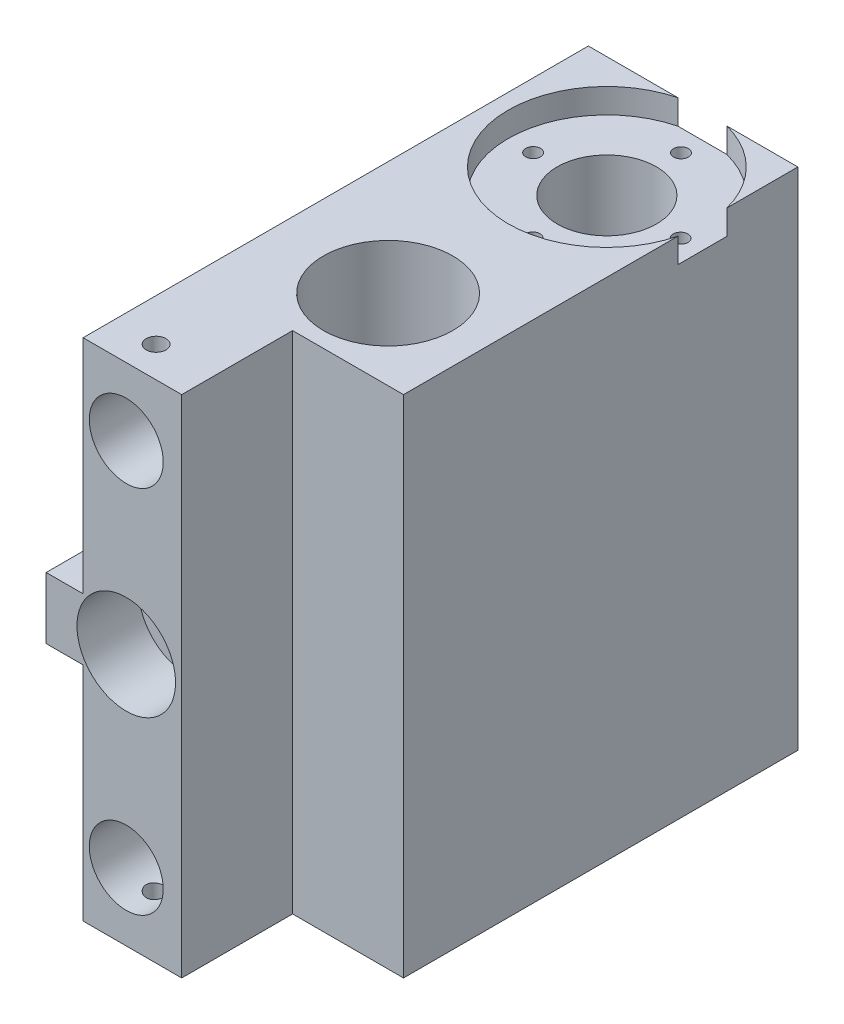
from build123d import *
from build123d.topology import SkipClean

# Parameters (mm, degrees)
SKETCH1_W           = 40
SKETCH1_H           = 82
SKETCH1_R           = 5.5
SKETCH1_R_2         = 6
BOSS_EXTRUDE1_DEPTH = 12
BOSS_EXTRUDE2_START = 70
SKETCH2_W           = 40
SKETCH2_H           = 82
SKETCH2_R           = 5.5
BOSS_EXTRUDE2_DEPTH = 70
SKETCH3_R           = 1.6
CUT_EXTRUDE1_DEPTH  = 10
CUT_EXTRUDE2_START  = -10
SKETCH4_R           = 1.6
CUT_EXTRUDE2_DEPTH  = 10
SKETCH5_R           = 10.5
SKETCH5_R_2         = 5.5
CUT_EXTRUDE3_DEPTH  = 100
SKETCH6_R           = 16
CUT_EXTRUDE4_DEPTH  = 4
SKETCH19_R          = 8.05
CUT_EXTRUDE17_DEPTH = 16
SKETCH12_R          = 1.2
CUT_EXTRUDE12_DEPTH = 12
SKETCH13_W          = 20
SKETCH13_H          = 70
BOSS_EXTRUDE3_DEPTH = 30
SKETCH14_R          = 2
CUT_EXTRUDE13_DEPTH = 12
CUT_EXTRUDE14_DEPTH = 115
SKETCH18_R          = 19.1
CUT_EXTRUDE16_DEPTH = 2
SKETCH20_W          = 18
SKETCH20_H          = 18
CUT_EXTRUDE18_DEPTH = 100
SKETCH21_R          = 8
CUT_EXTRUDE19_DEPTH = 10


with BuildPart() as part:
    # Sketch1 → Boss-Extrude1 (new body)
    with BuildSketch(Plane.XY):
        with Locations((-20, -41)):
            Rectangle(SKETCH1_W, SKETCH1_H)
        with Locations((-27, -41)):
            Circle(SKETCH1_R, mode=Mode.SUBTRACT)
        with Locations((-27, -11)):
            Circle(SKETCH1_R_2, mode=Mode.SUBTRACT)
        with Locations((-27, -71)):
            Circle(SKETCH1_R_2, mode=Mode.SUBTRACT)
    extrude(amount=BOSS_EXTRUDE1_DEPTH)

    # Sketch2 → Boss-Extrude2 (add)
    with SkipClean():  # the faces are left unmerged after this step: merging them gives an invalid solid
        with BuildSketch(Plane(origin=(0, 0, 0), x_dir=(-1, 0, 0), z_dir=(0, 0, -1)).offset(BOSS_EXTRUDE2_START)):
            with Locations((20, -41)):
                Rectangle(SKETCH2_W, SKETCH2_H)
            with Locations((27, -41)):
                Circle(SKETCH2_R, mode=Mode.SUBTRACT)
        extrude(amount=-BOSS_EXTRUDE2_DEPTH)

    # Sketch3 → Cut-Extrude1 (cut)
    with SkipClean():  # the faces are left unmerged after this step: merging them gives an invalid solid
        with BuildSketch(Plane(origin=(0, 0, 0), x_dir=(1, 0, 0), z_dir=(0, 1, 0))):
            with Locations((-27.154767421, -7)):
                Circle(SKETCH3_R)
        extrude(amount=-CUT_EXTRUDE1_DEPTH, mode=Mode.SUBTRACT)

    # Sketch4 → Cut-Extrude2 (cut)
    with SkipClean():  # the faces are left unmerged after this step: merging them gives an invalid solid
        with BuildSketch(Plane.XZ.offset(82).offset(CUT_EXTRUDE2_START)):
            with Locations((-27.154767421, 7)):
                Circle(SKETCH4_R)
        extrude(amount=CUT_EXTRUDE2_DEPTH, mode=Mode.SUBTRACT)

    # Sketch5 → Cut-Extrude3 (cut)
    with SkipClean():  # the faces are left unmerged after this step: merging them gives an invalid solid
        with BuildSketch(Plane(origin=(0, 0, 0), x_dir=(1, 0, 0), z_dir=(0, 1, 0))):
            with Locations((-15.5, 19)):
                Circle(SKETCH5_R)
            with Locations((-15.5, 54.5)):
                Circle(SKETCH5_R_2)
        extrude(amount=-CUT_EXTRUDE3_DEPTH, mode=Mode.SUBTRACT)

    # Sketch6 → Cut-Extrude4 (cut)
    with SkipClean():  # the faces are left unmerged after this step: merging them gives an invalid solid
        with BuildSketch(Plane(origin=(0, 0, 0), x_dir=(1, 0, 0), z_dir=(0, 1, 0))):
            with Locations((-15.5, 54.5)):
                Circle(SKETCH6_R)
        extrude(amount=-CUT_EXTRUDE4_DEPTH, mode=Mode.SUBTRACT)

    # Sketch19 → Cut-Extrude17 (cut)
    with SkipClean():  # the faces are left unmerged after this step: merging them gives an invalid solid
        with BuildSketch(Plane(origin=(0, -4, 0), x_dir=(1, 0, 0), z_dir=(0, 1, 0))):
            with Locations((-15.5, 54.5)):
                Circle(SKETCH19_R)
        extrude(amount=-CUT_EXTRUDE17_DEPTH, mode=Mode.SUBTRACT)

    # Sketch12 → Cut-Extrude12 (cut)
    with SkipClean():  # the faces are left unmerged after this step: merging them gives an invalid solid
        with BuildSketch(Plane(origin=(0, -4, 0), x_dir=(1, 0, 0), z_dir=(0, 1, 0))):
            with Locations((-15.530152912, 42.500037883)):
                Circle(SKETCH12_R)
            with Locations((-3.500037883, 54.469847088)):
                Circle(SKETCH12_R)
            with Locations((-15.469847088, 66.499962117)):
                Circle(SKETCH12_R)
            with Locations((-27.499962117, 54.530152912)):
                Circle(SKETCH12_R)
        extrude(amount=-CUT_EXTRUDE12_DEPTH, mode=Mode.SUBTRACT)

    # Sketch13 → Boss-Extrude3 (add)
    with SkipClean():  # the faces are left unmerged after this step: merging them gives an invalid solid
        with BuildSketch(Plane(origin=(0, 0, -70), x_dir=(-1, 0, 0), z_dir=(0, 0, -1))):
            with Locations((50, -35)):
                Rectangle(SKETCH13_W, SKETCH13_H)
        extrude(amount=-BOSS_EXTRUDE3_DEPTH)

    # Sketch14 → Cut-Extrude13 (cut)
    with SkipClean():  # the faces are left unmerged after this step: merging them gives an invalid solid
        with BuildSketch(Plane(origin=(0, 0, -70), x_dir=(-1, 0, 0), z_dir=(0, 0, -1))):
            with Locations((50.54, -41)):
                Circle(SKETCH14_R)
            with Locations((27, -17.46)):
                Circle(SKETCH14_R)
            with Locations((3.46, -41)):
                Circle(SKETCH14_R)
            with Locations((27, -64.54)):
                Circle(SKETCH14_R)
        extrude(amount=-CUT_EXTRUDE13_DEPTH, mode=Mode.SUBTRACT)

    # Sketch15 → Cut-Extrude14 (cut)
    with SkipClean():  # the faces are left unmerged after this step: merging them gives an invalid solid
        with BuildSketch(Plane(origin=(0, 0, -70), x_dir=(-1, 0, 0), z_dir=(0, 0, -1))):
            Polygon((34, 0), (34, -36), (54.581085422, -36), (54.581085422, -46), (34, -46), (34, -82), (77.520554958, -82), (77.520554958, 0), align=None)
        extrude(amount=-CUT_EXTRUDE14_DEPTH, mode=Mode.SUBTRACT)

    # Sketch18 → Cut-Extrude16 (cut)
    with SkipClean():  # the faces are left unmerged after this step: merging them gives an invalid solid
        with BuildSketch(Plane(origin=(0, 0, -70), x_dir=(-1, 0, 0), z_dir=(0, 0, -1))):
            with Locations((27, -41)):
                Circle(SKETCH18_R)
        extrude(amount=-CUT_EXTRUDE16_DEPTH, mode=Mode.SUBTRACT)

    # Sketch20 → Cut-Extrude18 (cut)
    with SkipClean():  # the faces are left unmerged after this step: merging them gives an invalid solid
        with BuildSketch(Plane.XZ.offset(82)):
            with Locations((-9, 3)):
                Rectangle(SKETCH20_W, SKETCH20_H)
        extrude(amount=-CUT_EXTRUDE18_DEPTH, mode=Mode.SUBTRACT)

    # Sketch21 → Cut-Extrude19 (cut)
    with BuildSketch(Plane.XY.offset(12)):
        with Locations((-27, -41)):
            Circle(SKETCH21_R)
    extrude(amount=-CUT_EXTRUDE19_DEPTH, mode=Mode.SUBTRACT)


solid = part.part
